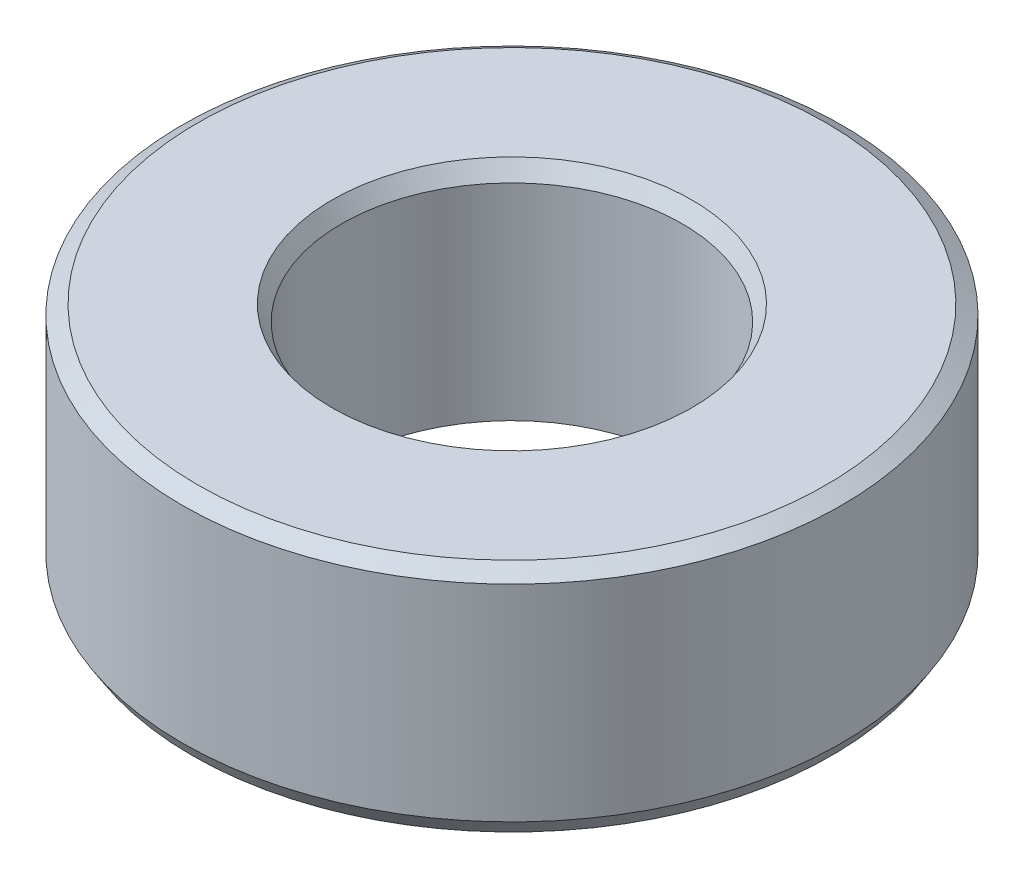
from build123d import *
from OCP.BRepFilletAPI import BRepFilletAPI_MakeChamfer

# Parameters (mm, degrees)
SKETCH1_R           = 50
BOSS_EXTRUDE1_DEPTH = 35.086401476
SKETCH2_R           = 25.832070126
CUT_EXTRUDE1_DEPTH  = 79.937035468
CHAMFER1_SIZE       = 1.479773036
CHAMFER1_SIZE2      = 2.373974878


with BuildPart() as part:
    # Sketch1 → Boss-Extrude1 (new body)
    with BuildSketch(Plane(origin=(0, 0, 0), x_dir=(1, 0, 0), z_dir=(0, 1, 0))):
        Circle(SKETCH1_R)
    extrude(amount=BOSS_EXTRUDE1_DEPTH)

    # Sketch2 → Cut-Extrude1 (cut, through all)
    with BuildSketch(Plane(origin=(0, 0, 0), x_dir=(1, 0, 0), z_dir=(0, 1, 0))):
        Circle(SKETCH2_R)
    extrude(amount=CUT_EXTRUDE1_DEPTH, mode=Mode.SUBTRACT)

    # Chamfer1: one chamfer whose edges measure the first distance from different faces: ONE call of the kernel's chamfer builder (chamfer() names one face for all edges)
    chamfer1_edges_1 = [part.edges().sort_by_distance(p)[0] for p in [
        (-25.832070126, 35.086401476, 0),
    ]]
    chamfer1_side_1 = [part.faces().sort_by_distance(p)[0] for p in [
        (-48.585786438, 35.086401476, 0),
    ]]
    chamfer1_edges_2 = [part.edges().sort_by_distance(p)[0] for p in [
        (-25.832070126, 0, 0),
    ]]
    chamfer1_side_2 = [part.faces().sort_by_distance(p)[0] for p in [
        (-25.832070126, 17.543200738, 0),
    ]]
    chamfer1_edges_3 = [part.edges().sort_by_distance(p)[0] for p in [
        (-50, 0, 0),
    ]]
    chamfer1_side_3 = [part.faces().sort_by_distance(p)[0] for p in [
        (-48.585786438, 0, 0),
    ]]
    chamfer1_edges_4 = [part.edges().sort_by_distance(p)[0] for p in [
        (-50, 35.086401476, 0),
    ]]
    chamfer1_side_4 = [part.faces().sort_by_distance(p)[0] for p in [
        (-50, 17.543200738, 0),
    ]]
    chamfer1 = BRepFilletAPI_MakeChamfer(part.part.solid().wrapped)
    for e in chamfer1_edges_1:
        chamfer1.Add(CHAMFER1_SIZE, CHAMFER1_SIZE2, e.wrapped, chamfer1_side_1[0].wrapped)  # the first distance lies on this face
    for e in chamfer1_edges_2:
        chamfer1.Add(CHAMFER1_SIZE, CHAMFER1_SIZE2, e.wrapped, chamfer1_side_2[0].wrapped)  # the first distance lies on this face
    for e in chamfer1_edges_3:
        chamfer1.Add(CHAMFER1_SIZE, CHAMFER1_SIZE2, e.wrapped, chamfer1_side_3[0].wrapped)  # the first distance lies on this face
    for e in chamfer1_edges_4:
        chamfer1.Add(CHAMFER1_SIZE, CHAMFER1_SIZE2, e.wrapped, chamfer1_side_4[0].wrapped)  # the first distance lies on this face
    add(Compound.cast(chamfer1.Shape()), mode=Mode.REPLACE)


solid = part.part
